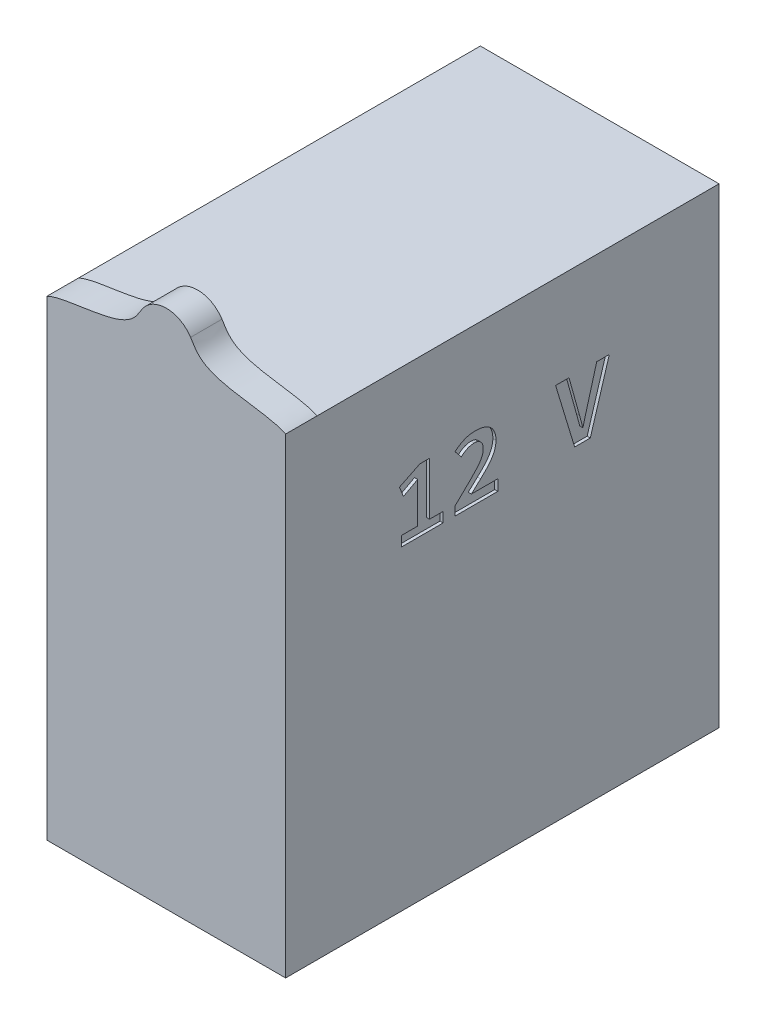
from build123d import *

# Parameters (mm, degrees)
SKETCH1_W           = 3.8
SKETCH1_H           = 8
BOSS_EXTRUDE1_DEPTH = 3.45
BOSS_EXTRUDE3_START = -0.5
BOSS_EXTRUDE3_DEPTH = 0.5
CHAMFER2_SIZE       = 0.5
SKETCH8_RX          = 2.494560644
SKETCH8_RY          = 0.718935273
CUT_EXTRUDE2_DEPTH  = 0.05
CUT_EXTRUDE3_DEPTH  = 0.05


# Read off the part's stored shape, not the designer's step: Boss-Extrude3
with BuildPart() as part:
    # Sketch1 → Boss-Extrude1 (new, symmetric)
    with BuildSketch(Plane.XY):
        Rectangle(SKETCH1_W, SKETCH1_H)
    extrude(amount=BOSS_EXTRUDE1_DEPTH, both=True)

    # Boss-Extrude3 outline → Boss-Extrude3 (add)
    with BuildSketch(Plane.XY.offset(3.45).offset(BOSS_EXTRUDE3_START)):
        with BuildLine():
            ThreePointArc((0.386782268, 4.576881383), (0, 4.785801899), (-0.386782268, 4.576881383))
            add(Edge.make_bspline(
                [(-0.386782268, 4.576881383), (-0.522104533, 4.370469494), (-0.576485167, 4.110258291), (-1.543568904, 4.182658763), (-1.9, 4)],
                knots=[0, 0, 0, 0, 0, 1, 1, 1, 1, 1], degree=4))
            Line((-1.9, 4), (1.9, 4))
            add(Edge.make_bspline(
                [(1.9, 4), (1.543568904, 4.182658763), (0.576485167, 4.110258291), (0.522104533, 4.370469494), (0.386782268, 4.576881383)],
                knots=[0, 0, 0, 0, 0, 1, 1, 1, 1, 1], degree=4))
        make_face()
    extrude(amount=BOSS_EXTRUDE3_DEPTH)

    # Chamfer2
    chamfer2_edges = [part.edges().sort_by_distance(p)[0] for p in [
        (0, -4, 3.45),
        (0, -4, -3.45),
        (1.9, -4, 0),
        (-1.9, -4, 0),
    ]]
    chamfer(chamfer2_edges, length=CHAMFER2_SIZE)

    # Sketch8 → Cut-Extrude2 (cut, symmetric)
    with BuildSketch(Plane.XZ.offset(4)):
        with Locations(Location((0, 0), (0, 0, 90))):
            Ellipse(SKETCH8_RX, SKETCH8_RY)
    extrude(amount=CUT_EXTRUDE2_DEPTH, both=True, mode=Mode.SUBTRACT)

    # Sketch9 → Cut-Extrude3 (cut, symmetric)
    with BuildSketch(Plane(origin=(1.9, 0, 0), x_dir=(0, 0, -1), z_dir=(1, 0, 0))):
        Polygon((-1.608695652, 1.52039879), (-1.608695652, 1.67981908), (-1.347826087, 1.67981908), (-1.347826087, 2.32361437), (-1.57495471, 2.20155821), (-1.637681159, 2.3609785), (-1.313405797, 2.52039879), (-1.15942029, 2.52039879), (-1.15942029, 1.67981908), (-0.942028986, 1.67981908), (-0.942028986, 1.52039879), align=None)
        with BuildLine():
            Line((-0.753623188, 1.52039879), (-0.753623188, 1.660117993))
            Line((-0.753623188, 1.660117993), (-0.512681159, 1.893587196))
            add(Edge.make_bspline(
                [(-0.512681159, 1.893587196), (-0.5018156, 1.904159463), (-0.481039355, 1.924374897), (-0.452427524, 1.954418318), (-0.426714142, 1.981714894), (-0.404257947, 2.007005685), (-0.384911278, 2.030762388), (-0.367887318, 2.052940622), (-0.35307316, 2.073689639), (-0.340721742, 2.093374099), (-0.330364569, 2.111983404), (-0.322256202, 2.129907311), (-0.31575837, 2.146967443), (-0.309698908, 2.168941676), (-0.305493732, 2.196715837), (-0.304731855, 2.219056371), (-0.304347826, 2.230317268)],
                knots=[0, 0, 0, 0, 1.561346149, 2.985479849, 4.272660798, 5.42387168, 6.4681479, 7.427594435, 8.303382019, 9.092890023, 9.820107477, 10.495077279, 11.117492523, 11.698467986, 12.839897307, 14, 14, 14, 14], degree=3))
            add(Edge.make_bspline(
                [(-0.304347826, 2.230317268), (-0.304749324, 2.239951277), (-0.305544487, 2.259031359), (-0.312869331, 2.286419819), (-0.32389769, 2.31167432), (-0.340192786, 2.333284373), (-0.360528944, 2.351500926), (-0.381140537, 2.36269725), (-0.399534406, 2.369207499), (-0.414564764, 2.372786302), (-0.430554514, 2.375179437), (-0.44156686, 2.375372066), (-0.447237319, 2.375471254)],
                knots=[0, 0, 0, 0, 1.259052347, 2.493543675, 3.687736162, 4.846054809, 6.008246034, 7.237941048, 7.888132915, 8.5593184, 9.258166694, 10, 10, 10, 10], degree=3))
            add(Edge.make_bspline(
                [(-0.447237319, 2.375471254), (-0.456988906, 2.375134553), (-0.476209579, 2.374470906), (-0.504504735, 2.370167962), (-0.531680703, 2.362610737), (-0.557705297, 2.352017107), (-0.583009083, 2.339296512), (-0.607369703, 2.324204601), (-0.631341549, 2.307520425), (-0.646378777, 2.294899268), (-0.653985507, 2.288514732)],
                knots=[0, 0, 0, 0, 1.020414048, 2.011267059, 2.986668027, 3.96497488, 4.94697347, 5.946696085, 6.961316025, 8, 8, 8, 8], degree=3))
            Line((-0.653985507, 2.288514732), (-0.753623188, 2.408759297))
            add(Edge.make_bspline(
                [(-0.753623188, 2.408759297), (-0.742518604, 2.418001221), (-0.72030534, 2.436488477), (-0.68431817, 2.460977212), (-0.646234813, 2.482437605), (-0.606269993, 2.50111137), (-0.564434736, 2.516559351), (-0.520470754, 2.52692615), (-0.474936737, 2.533905774), (-0.443942977, 2.534559711), (-0.42821558, 2.534891543)],
                knots=[0, 0, 0, 0, 0.971414743, 1.943187718, 2.923163908, 3.90905488, 4.908116413, 5.916732171, 6.942871654, 8, 8, 8, 8], degree=3))
            add(Edge.make_bspline(
                [(-0.42821558, 2.534891543), (-0.416203685, 2.534703898), (-0.392650983, 2.534335966), (-0.358220001, 2.530579803), (-0.325504013, 2.524775686), (-0.294589327, 2.516626165), (-0.265532929, 2.506251119), (-0.2384809, 2.493601472), (-0.213635967, 2.478599538), (-0.191054535, 2.461304731), (-0.17078899, 2.441689013), (-0.15269922, 2.419840212), (-0.137363523, 2.395482265), (-0.124395242, 2.368994948), (-0.113833889, 2.340452893), (-0.106835404, 2.309612456), (-0.102028057, 2.27681502), (-0.101645917, 2.254188651), (-0.101449275, 2.242545529)],
                knots=[0, 0, 0, 0, 1.159472778, 2.273472863, 3.340013536, 4.365414322, 5.356781803, 6.31537468, 7.244130825, 8.153815157, 9.055875647, 9.962049253, 10.886103095, 11.828148954, 12.805810483, 13.817047342, 14.876691883, 16, 16, 16, 16], degree=3))
            add(Edge.make_bspline(
                [(-0.101449275, 2.242545529), (-0.101573271, 2.232797158), (-0.10181811, 2.213548196), (-0.105266832, 2.185201632), (-0.109988074, 2.157717091), (-0.117468921, 2.131299919), (-0.126556111, 2.105586764), (-0.13745779, 2.08027856), (-0.150492092, 2.055452632), (-0.164982926, 2.030681159), (-0.181295483, 2.006109055), (-0.19988108, 1.981983737), (-0.219700719, 1.957357861), (-0.241779881, 1.933018624), (-0.265556322, 1.908393081), (-0.290302007, 1.882559449), (-0.317355297, 1.856767431), (-0.335891122, 1.839304984), (-0.345335145, 1.830407848)],
                knots=[0, 0, 0, 0, 0.945736526, 1.867434716, 2.768631143, 3.650402628, 4.528787893, 5.414963327, 6.32280855, 7.249039709, 8.200182995, 9.183579422, 10.204429958, 11.268168642, 12.372135405, 13.527717836, 14.740369513, 16, 16, 16, 16], degree=3))
            Line((-0.345335145, 1.830407848), (-0.492753623, 1.694311833))
            Line((-0.492753623, 1.694311833), (-0.072463768, 1.694311833))
            Line((-0.072463768, 1.694311833), (-0.072463768, 1.52039879))
            Line((-0.072463768, 1.52039879), (-0.753623188, 1.52039879))
        make_face()
        Polygon((1.400362319, 1.52039879), (1.151268116, 1.52039879), (0.847826087, 2.52039879), (1.061141304, 2.52039879), (1.228713768, 1.918270167), (1.282608696, 1.720806399), (1.338088768, 1.92959263), (1.502717391, 2.52039879), (1.702898551, 2.52039879), align=None)
    extrude(amount=CUT_EXTRUDE3_DEPTH, both=True, mode=Mode.SUBTRACT)


solid = part.part
